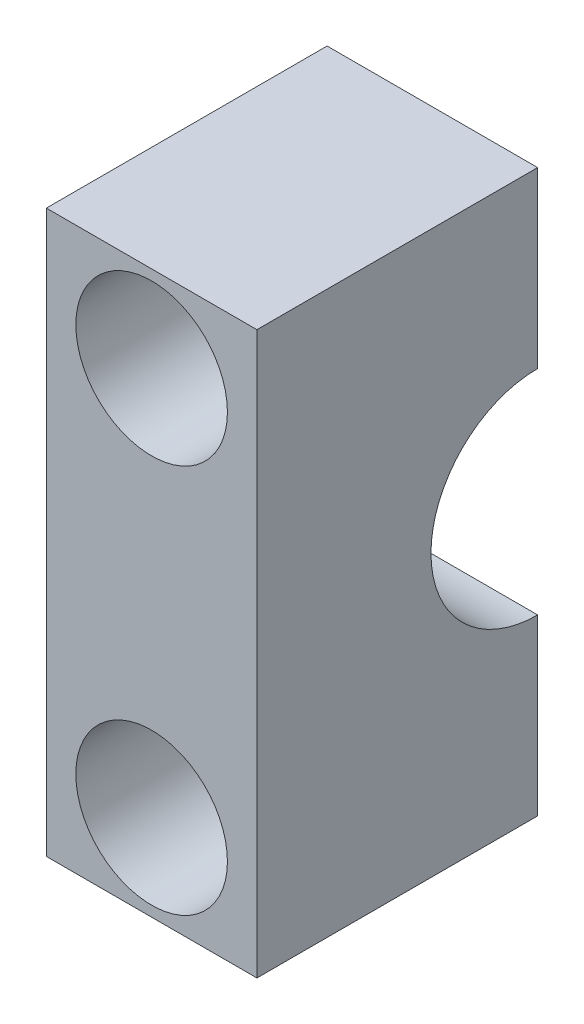
from build123d import *

# Parameters (mm, degrees)
SKETCH1_W           = 9.525
SKETCH1_H           = 25.4
BOSS_EXTRUDE1_DEPTH = 12.7
SKETCH2_R           = 3.429
CUT_EXTRUDE1_DEPTH  = 6.35
SKETCH3_R           = 1.397
CUT_EXTRUDE2_DEPTH  = 15.976445047
SKETCH4_R           = 4.826
CUT_EXTRUDE3_DEPTH  = 21.329919454


with BuildPart() as part:
    # Sketch1 → Boss-Extrude1 (new body)
    with BuildSketch(Plane.XY):
        Rectangle(SKETCH1_W, SKETCH1_H)
    extrude(amount=BOSS_EXTRUDE1_DEPTH)

    # Sketch2 → Cut-Extrude1 (cut)
    with BuildSketch(Plane.XY.offset(12.7)):
        with Locations((0, 8.8011)):
            Circle(SKETCH2_R)
        with Locations((0, -8.8011)):
            Circle(SKETCH2_R)
    extrude(amount=-CUT_EXTRUDE1_DEPTH, mode=Mode.SUBTRACT)

    # Sketch3 → Cut-Extrude2 (cut, through all)
    with BuildSketch(Plane.XY.offset(6.35)):
        with Locations((0, 8.8011)):
            Circle(SKETCH3_R)
        with Locations((0, -8.8011)):
            Circle(SKETCH3_R)
    extrude(amount=-CUT_EXTRUDE2_DEPTH, mode=Mode.SUBTRACT)

    # Sketch4 → Cut-Extrude3 (cut, through all)
    with BuildSketch(Plane.ZY.offset(4.7625)):
        Circle(SKETCH4_R)
    extrude(amount=-CUT_EXTRUDE3_DEPTH, mode=Mode.SUBTRACT)


solid = part.part
